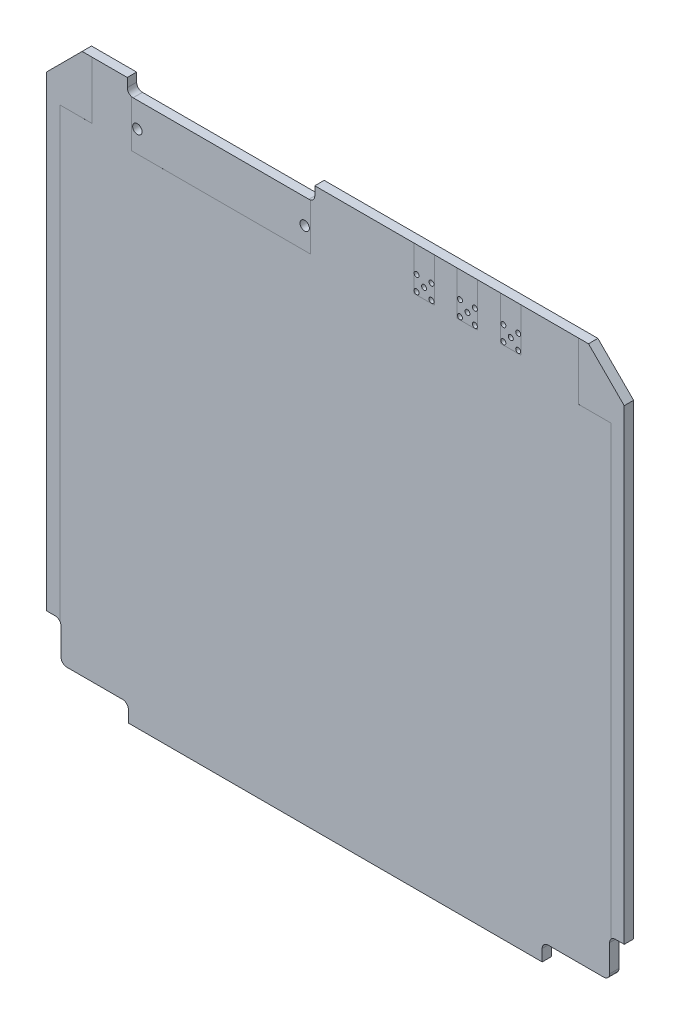
from build123d import *

# Parameters (mm, degrees)
SKETCH1_R           = 0.425
SKETCH1_R_2         = 0.8
BOSS_EXTRUDE1_DEPTH = 1.6
CUT_EXTRUDE1_DEPTH  = 0.0001
CUT_EXTRUDE2_DEPTH  = 0.0001
PARTFOOTPRINTS_W    = 30.48
PARTFOOTPRINTS_H    = 7.989227112
PARTFOOTPRINTS_W_2  = 3.5
PARTFOOTPRINTS_H_2  = 7.45
CUT_EXTRUDE3_DEPTH  = 0.0001


with BuildPart() as part:
    # Sketch1 → Boss-Extrude1 (new body)
    with BuildSketch(Plane(origin=(0, 0, -0.0125), x_dir=(-1, 0, 0), z_dir=(0, 0, -1))):
        with BuildLine():
            Line((35.3, -50), (35.3, -48))
            ThreePointArc((35.3, -48), (35.592893219, -47.292893219), (36.3, -47))
            Line((36.3, -47), (45.8, -47))
            ThreePointArc((45.8, -47), (46.507106781, -46.707106781), (46.8, -46))
            Line((46.8, -46), (46.8, -41.4))
            ThreePointArc((46.8, -41.4), (47.092893219, -40.692893219), (47.8, -40.4))
            Line((47.8, -40.4), (49.3, -40.4))
            Line((49.3, -40.4), (49.3, 39.2))
            Line((49.3, 39.2), (43.2, 45.3))
            Line((43.2, 45.3), (35.500000002, 45.3))
            Line((35.500000002, 45.3), (35.500000002, 43.8))
            ThreePointArc((35.500000002, 43.8), (35.207106783, 43.092893219), (34.500000002, 42.8))
            Line((34.500000002, 42.8), (4.499999998, 42.8))
            ThreePointArc((4.499999998, 42.8), (3.792893217, 43.092893219), (3.499999998, 43.8))
            Line((3.499999998, 43.8), (3.499999998, 45.3))
            Line((3.499999998, 45.3), (-43.2, 45.3))
            Line((-43.2, 45.3), (-49.3, 39.2))
            Line((-49.3, 39.2), (-49.3, -40.4))
            Line((-49.3, -40.4), (-47.8, -40.4))
            ThreePointArc((-47.8, -40.4), (-47.092893219, -40.692893219), (-46.8, -41.4))
            Line((-46.8, -41.4), (-46.8, -46))
            ThreePointArc((-46.8, -46), (-46.507106781, -46.707106781), (-45.8, -47))
            Line((-45.8, -47), (-36.3, -47))
            ThreePointArc((-36.3, -47), (-35.592893219, -47.292893219), (-35.3, -48))
            Line((-35.3, -48), (-35.3, -50))
            Line((-35.3, -50), (35.3, -50))
        make_face()
        with Locations((-21.27, 40.87)):
            Circle(SKETCH1_R, mode=Mode.SUBTRACT)
        with Locations((-23.81, 40.87)):
            Circle(SKETCH1_R, mode=Mode.SUBTRACT)
        with Locations((-22.54, 39.6)):
            Circle(SKETCH1_R, mode=Mode.SUBTRACT)
        with Locations((-13.87, 40.87)):
            Circle(SKETCH1_R, mode=Mode.SUBTRACT)
        with Locations((-23.81, 38.33)):
            Circle(SKETCH1_R, mode=Mode.SUBTRACT)
        with Locations((-16.41, 40.87)):
            Circle(SKETCH1_R, mode=Mode.SUBTRACT)
        with Locations((-15.14, 39.6)):
            Circle(SKETCH1_R, mode=Mode.SUBTRACT)
        with Locations((-21.27, 38.33)):
            Circle(SKETCH1_R, mode=Mode.SUBTRACT)
        with Locations((-28.67, 40.87)):
            Circle(SKETCH1_R, mode=Mode.SUBTRACT)
        with Locations((-31.21, 40.87)):
            Circle(SKETCH1_R, mode=Mode.SUBTRACT)
        with Locations((-16.41, 38.33)):
            Circle(SKETCH1_R, mode=Mode.SUBTRACT)
        with Locations((-29.94, 39.6)):
            Circle(SKETCH1_R, mode=Mode.SUBTRACT)
        with Locations((-31.21, 38.33)):
            Circle(SKETCH1_R, mode=Mode.SUBTRACT)
        with Locations((-28.67, 38.33)):
            Circle(SKETCH1_R, mode=Mode.SUBTRACT)
        with Locations((33.775, 38.54)):
            Circle(SKETCH1_R_2, mode=Mode.SUBTRACT)
        with Locations((5.225, 38.54)):
            Circle(SKETCH1_R_2, mode=Mode.SUBTRACT)
        with Locations((-13.87, 38.33)):
            Circle(SKETCH1_R, mode=Mode.SUBTRACT)
    extrude(amount=-BOSS_EXTRUDE1_DEPTH)

    # thermalContacts_lower → Cut-Extrude1 (cut)
    with BuildSketch(Plane(origin=(0, 0, -0.0125), x_dir=(-1, 0, 0), z_dir=(0, 0, -1))):
        Polygon((47, 35.5), (47, -41.5), (59.827263463, -41.5), (59.827263463, 47), (41.5, 47), (41.5, 41.5), (41.5, 35.5), align=None)
        Polygon((-47, 35.5), (-47, -41.5), (-56.192158269, -41.5), (-56.192158269, 47), (-41.5, 47), (-41.5, 41.5), (-41.5, 35.5), align=None)
    extrude(amount=-CUT_EXTRUDE1_DEPTH, mode=Mode.SUBTRACT)

    # thermalContacts_upper → Cut-Extrude2 (cut)
    with BuildSketch(Plane.XY.offset(1.5875)):
        Polygon((-47, 35.5), (-47, -41.5), (-56.192158269, -41.5), (-56.192158269, 47), (-41.5, 47), (-41.5, 41.5), (-41.5, 35.5), align=None)
        Polygon((47, 35.5), (47, -41.5), (59.827263463, -41.5), (59.827263463, 47), (41.5, 47), (41.5, 41.5), (41.5, 35.5), align=None)
    extrude(amount=-CUT_EXTRUDE2_DEPTH, mode=Mode.SUBTRACT)

    # partFootprints → Cut-Extrude3 (cut)
    with BuildSketch(Plane.XY.offset(1.5875)):
        with Locations((-19.5, 38.834613556)):
            Rectangle(PARTFOOTPRINTS_W, PARTFOOTPRINTS_H)
        with Locations((15.14, 41.575)):
            Rectangle(PARTFOOTPRINTS_W_2, PARTFOOTPRINTS_H_2)
        with Locations((22.54, 41.575)):
            Rectangle(PARTFOOTPRINTS_W_2, PARTFOOTPRINTS_H_2)
        with Locations((29.94, 41.575)):
            Rectangle(PARTFOOTPRINTS_W_2, PARTFOOTPRINTS_H_2)
    extrude(amount=-CUT_EXTRUDE3_DEPTH, mode=Mode.SUBTRACT)


solid = part.part
